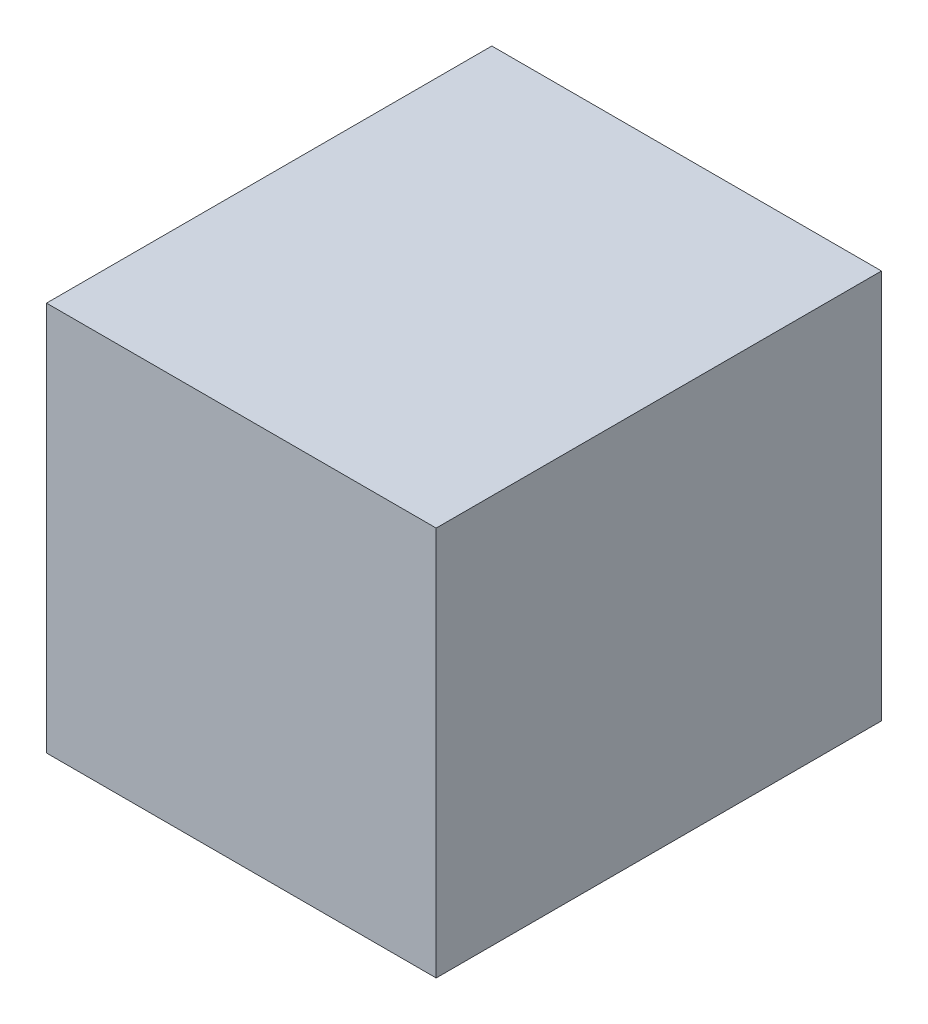
from build123d import *

# Parameters (mm, degrees)
SKETCH1_R           = 10
BOSS_EXTRUDE1_DEPTH = 10
SKETCH2_W           = 35
SKETCH2_H           = 35
SKETCH2_R           = 15
BOSS_EXTRUDE2_DEPTH = 15
SKETCH3_W           = 35
SKETCH3_H           = 35
BOSS_EXTRUDE3_DEPTH = 5


with BuildPart() as part:
    # Sketch1 → Boss-Extrude1 (new, symmetric)
    with BuildSketch(Plane.XY):
        Circle(SKETCH1_R)
    extrude(amount=BOSS_EXTRUDE1_DEPTH, both=True)


with BuildPart() as body_2:
    # Sketch2 → Boss-Extrude2 (new, symmetric)
    with BuildSketch(Plane.XY):
        Rectangle(SKETCH2_W, SKETCH2_H)
        Circle(SKETCH2_R, mode=Mode.SUBTRACT)
    extrude(amount=BOSS_EXTRUDE2_DEPTH, both=True)

    # Sketch3 → Boss-Extrude3 (add)
    with BuildSketch(Plane.XY.offset(15)):
        Rectangle(SKETCH3_W, SKETCH3_H)
    boss_extrude3 = extrude(amount=BOSS_EXTRUDE3_DEPTH)

    # Mirror1: Boss-Extrude3 across plane
    add(boss_extrude3.mirror(Plane.XY))


solid = Compound([part.part, body_2.part])
